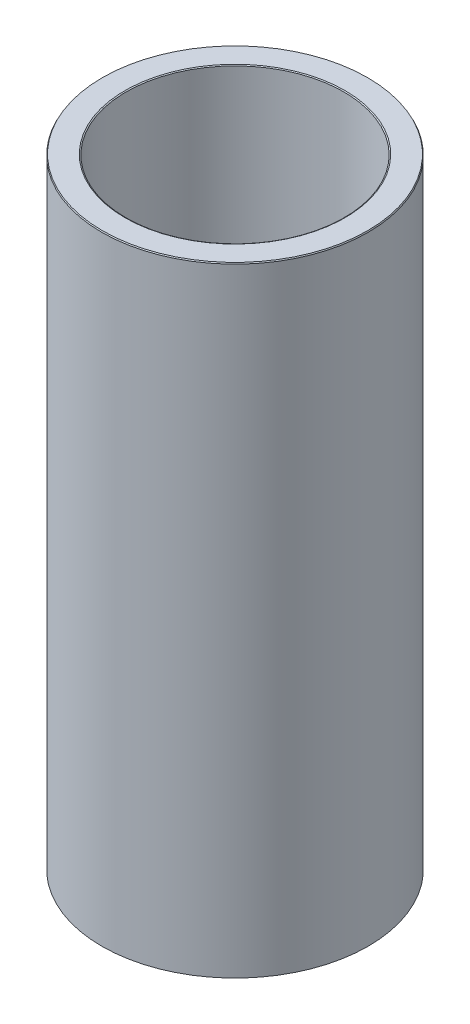
from build123d import *
from OCP.BRepFilletAPI import BRepFilletAPI_MakeChamfer

# Parameters (mm, degrees)
SKETCH1_R           = 35
BOSS_EXTRUDE1_DEPTH = 162.881200186
SKETCH2_R           = 28.638142827
CUT_EXTRUDE1_DEPTH  = 171.235969683
CHAMFER1_SIZE       = 0.287501041
CHAMFER1_SIZE2      = 0.167708948


with BuildPart() as part:
    # Sketch1 → Boss-Extrude1 (new body)
    with BuildSketch(Plane(origin=(0, 0, 0), x_dir=(1, 0, 0), z_dir=(0, 1, 0))):
        Circle(SKETCH1_R)
    extrude(amount=BOSS_EXTRUDE1_DEPTH)

    # Sketch2 → Cut-Extrude1 (cut, through all)
    with BuildSketch(Plane(origin=(0, 0, 0), x_dir=(1, 0, 0), z_dir=(0, 1, 0))):
        Circle(SKETCH2_R)
    extrude(amount=CUT_EXTRUDE1_DEPTH, mode=Mode.SUBTRACT)

    # Chamfer1: one chamfer whose edges measure the first distance from different faces: ONE call of the kernel's chamfer builder (chamfer() names one face for all edges)
    chamfer1_edges_1 = [part.edges().sort_by_distance(p)[0] for p in [
        (-28.638142827, 162.881200186, 0),
    ]]
    chamfer1_side_1 = [part.faces().sort_by_distance(p)[0] for p in [
        (-34.010050506, 162.881200186, 0),
    ]]
    chamfer1_edges_2 = [part.edges().sort_by_distance(p)[0] for p in [
        (-28.638142827, 0, 0),
    ]]
    chamfer1_side_2 = [part.faces().sort_by_distance(p)[0] for p in [
        (-28.638142827, 81.440600093, 0),
    ]]
    chamfer1_edges_3 = [part.edges().sort_by_distance(p)[0] for p in [
        (-35, 0, 0),
    ]]
    chamfer1_side_3 = [part.faces().sort_by_distance(p)[0] for p in [
        (-34.010050506, 0, 0),
    ]]
    chamfer1_edges_4 = [part.edges().sort_by_distance(p)[0] for p in [
        (-35, 162.881200186, 0),
    ]]
    chamfer1_side_4 = [part.faces().sort_by_distance(p)[0] for p in [
        (-35, 81.440600093, 0),
    ]]
    chamfer1 = BRepFilletAPI_MakeChamfer(part.part.solid().wrapped)
    for e in chamfer1_edges_1:
        chamfer1.Add(CHAMFER1_SIZE, CHAMFER1_SIZE2, e.wrapped, chamfer1_side_1[0].wrapped)  # the first distance lies on this face
    for e in chamfer1_edges_2:
        chamfer1.Add(CHAMFER1_SIZE, CHAMFER1_SIZE2, e.wrapped, chamfer1_side_2[0].wrapped)  # the first distance lies on this face
    for e in chamfer1_edges_3:
        chamfer1.Add(CHAMFER1_SIZE, CHAMFER1_SIZE2, e.wrapped, chamfer1_side_3[0].wrapped)  # the first distance lies on this face
    for e in chamfer1_edges_4:
        chamfer1.Add(CHAMFER1_SIZE, CHAMFER1_SIZE2, e.wrapped, chamfer1_side_4[0].wrapped)  # the first distance lies on this face
    add(Compound.cast(chamfer1.Shape()), mode=Mode.REPLACE)


solid = part.part
